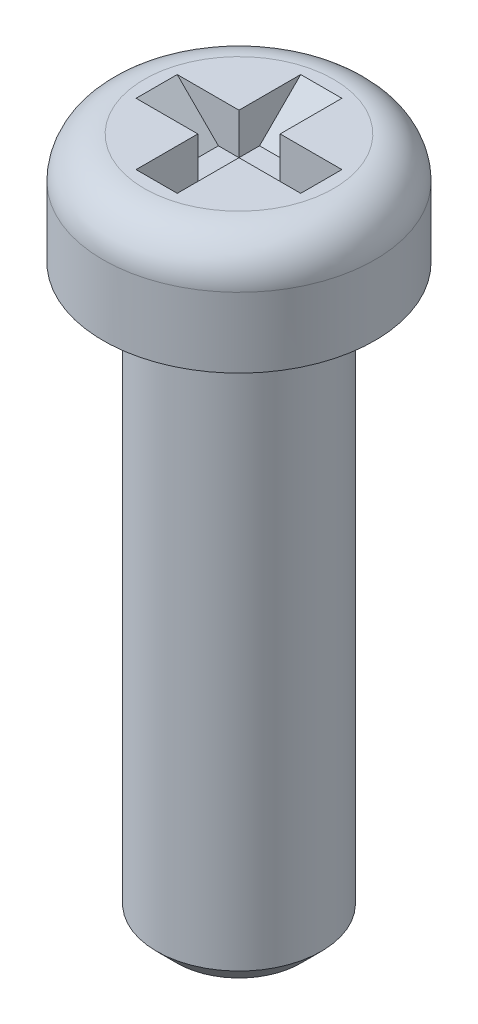
from build123d import *

# Parameters (mm, degrees)
SKETCH_1_R          = 2
EXTRUDE_1_DEPTH     = 14
SKETCH_2_R          = 3.3
EXTRUDE_2_DEPTH     = 2.7
FILLET_1_R          = 1
CHAMFER_1_SIZE      = 0.5
SKETCH_3_W          = 4
SKETCH_3_H          = 1
SKETCH_3_W_2        = 1
SKETCH_3_H_2        = 4
CUT_EXTRUDE_1_DEPTH = 1
CHAMFER_2_SIZE      = 1


with BuildPart() as part:
    # 草图1 → 凸台-拉伸1 (new body)
    with BuildSketch(Plane(origin=(0, 0, 0), x_dir=(1, 0, 0), z_dir=(0, 1, 0))):
        with Locations(Location((0, 0, 0), (0, 0, 270))):
            Circle(SKETCH_1_R)
    extrude(amount=EXTRUDE_1_DEPTH)

    # 草图2 → 凸台-拉伸2 (add)
    with BuildSketch(Plane(origin=(0, 14, 0), x_dir=(1, 0, 0), z_dir=(0, 1, 0))):
        with Locations(Location((0, 0, 0), (0, 0, 90))):
            Circle(SKETCH_2_R)
    extrude(amount=EXTRUDE_2_DEPTH)

    # 圆角1
    fillet_1_edges = [part.edges().sort_by_distance(p)[0] for p in [
        (0, 16.7, 3.3),
    ]]
    fillet(fillet_1_edges, radius=FILLET_1_R)

    # 倒角1
    chamfer_1_edges = [part.edges().sort_by_distance(p)[0] for p in [
        (0, 0, -2),
    ]]
    chamfer(chamfer_1_edges, length=CHAMFER_1_SIZE)

    # 草图3 → 切除-拉伸-薄壁1 (cut)
    with BuildSketch(Plane(origin=(0, 16.7, 0), x_dir=(1, 0, 0), z_dir=(0, 1, 0))):
        Rectangle(SKETCH_3_W, SKETCH_3_H)
        Rectangle(SKETCH_3_W_2, SKETCH_3_H_2)
    extrude(amount=-CUT_EXTRUDE_1_DEPTH, mode=Mode.SUBTRACT)

    # 倒角2
    chamfer_2_edges = [part.edges().sort_by_distance(p)[0] for p in [
        (0, 15.7, 2),
        (2, 15.7, 0),
        (0, 15.7, -2),
        (-2, 15.7, 0),
    ]]
    chamfer(chamfer_2_edges, length=CHAMFER_2_SIZE - 0.0001)  # a hair under: the kernel refuses the full size


solid = part.part
